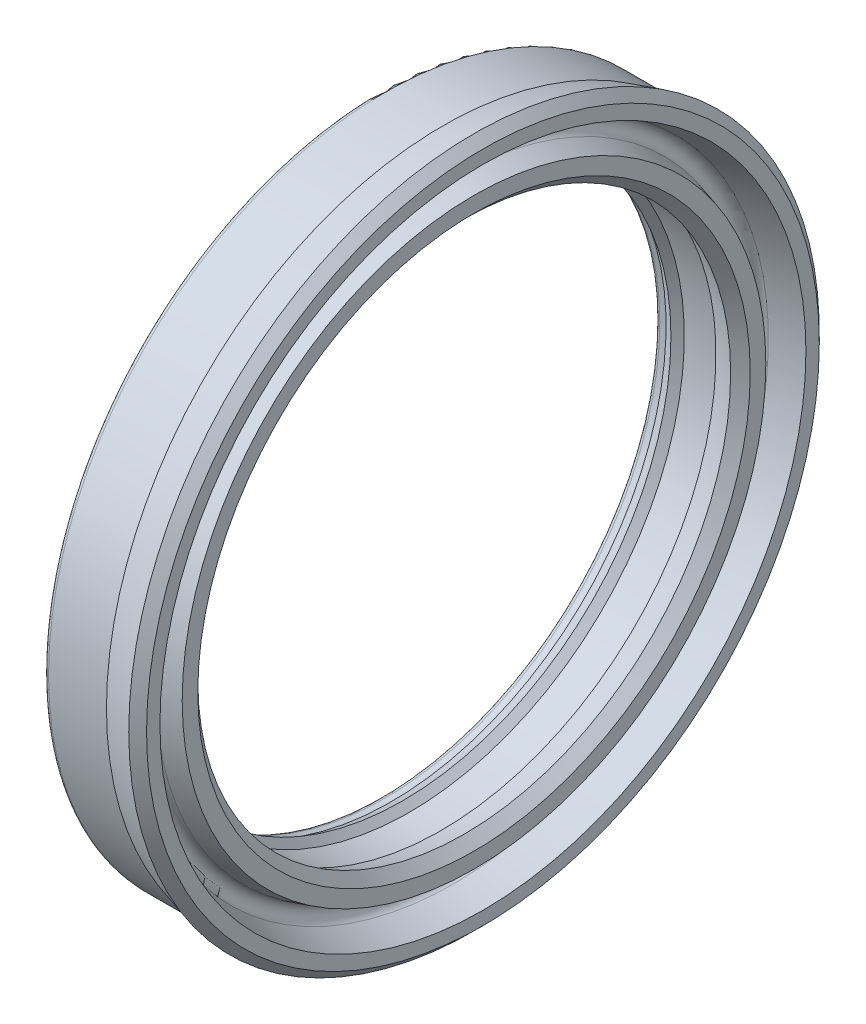
from build123d import *

# Parameters (mm, degrees)
FILLET1_R = 0.5


with BuildPart() as part:
    # Sketch1 → Revolve1 (revolve)
    with BuildSketch(Plane.XY):
        with BuildLine():
            Line((0, 30.85), (0, 37.75))
            Line((0, 37.75), (7, 37.75))
            Line((7, 37.75), (10.5, 38.75))
            Line((10.5, 38.75), (11.5, 37.75))
            Line((11.5, 37.75), (11.5, 36.25))
            Line((11.5, 36.25), (8.224507889, 35.311303332))
            ThreePointArc((8.224507889, 35.311303332), (7.500003732, 34.347267981), (8.229764579, 33.387205724))
            Line((8.229764579, 33.387205724), (10.5, 32.75))
            Line((10.5, 32.75), (10.5, 31))
            Line((10.5, 31), (9.4, 29.9))
            Line((9.4, 29.9), (6.8, 30.85))
            Line((6.8, 30.85), (3.25, 30.85))
            Line((3.25, 30.85), (2.5, 30.1))
            Line((2.5, 30.1), (1.200961894, 30.85))
            Line((1.200961894, 30.85), (0, 30.85))
        make_face()
    revolve(axis=Axis((0, 0, 0), (1, 0, 0)))

    # Fillet1
    fillet1_edges = [part.edges().sort_by_distance(p)[0] for p in [
        (0, -30.85, 0),
        (0, -37.75, 0),
    ]]
    fillet(fillet1_edges, radius=FILLET1_R)


solid = part.part
